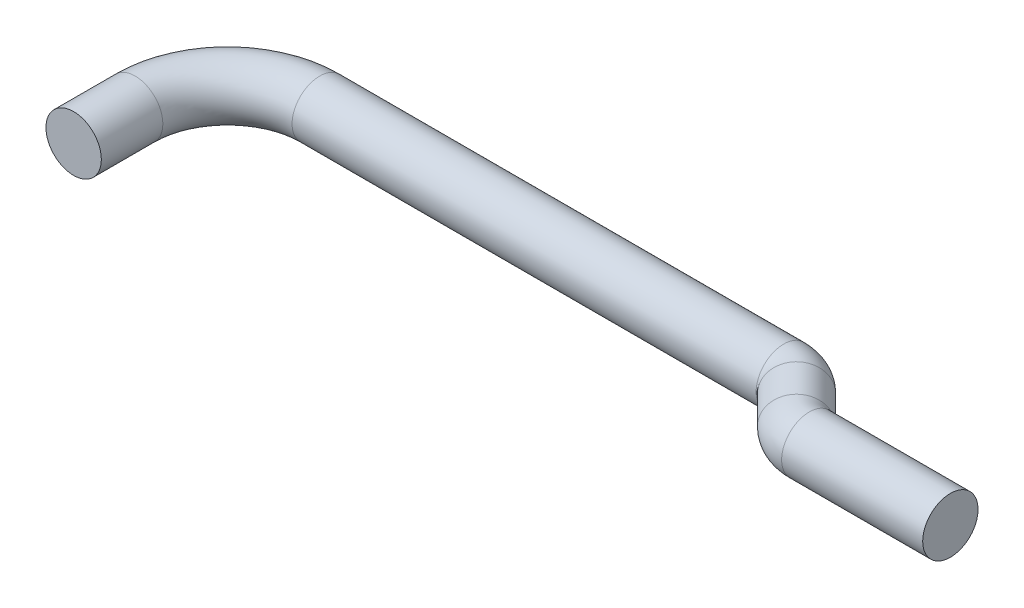
from build123d import *

# Parameters (mm, degrees)
SKETCH2_R = 9


with BuildPart() as part:
    # Sweep1: sweep along a path in Sketch1
    with BuildLine(Plane(origin=(0, 0, 0), x_dir=(1, 0, 0), z_dir=(0, 1, 0))) as sweep1_path:
        Line((250, 35), (204.142135624, 35))
        ThreePointArc((204.142135624, 35), (200.3153013, 35.761204675), (197.071067812, 37.928932188))
        Line((197.071067812, 37.928932188), (187.928932188, 47.071067812))
        ThreePointArc((187.928932188, 47.071067812), (184.6846987, 49.238795325), (180.857864376, 50))
        Line((180.857864376, 50), (30, 50))
        ThreePointArc((30, 50), (8.786796564, 41.213203436), (0, 20))
        Line((0, 20), (0, 0))
    # Sketch2 → Sweep1 (sweep)
    with BuildSketch(Plane.XY):
        Circle(SKETCH2_R)
    sweep(path=sweep1_path.line)


solid = part.part
